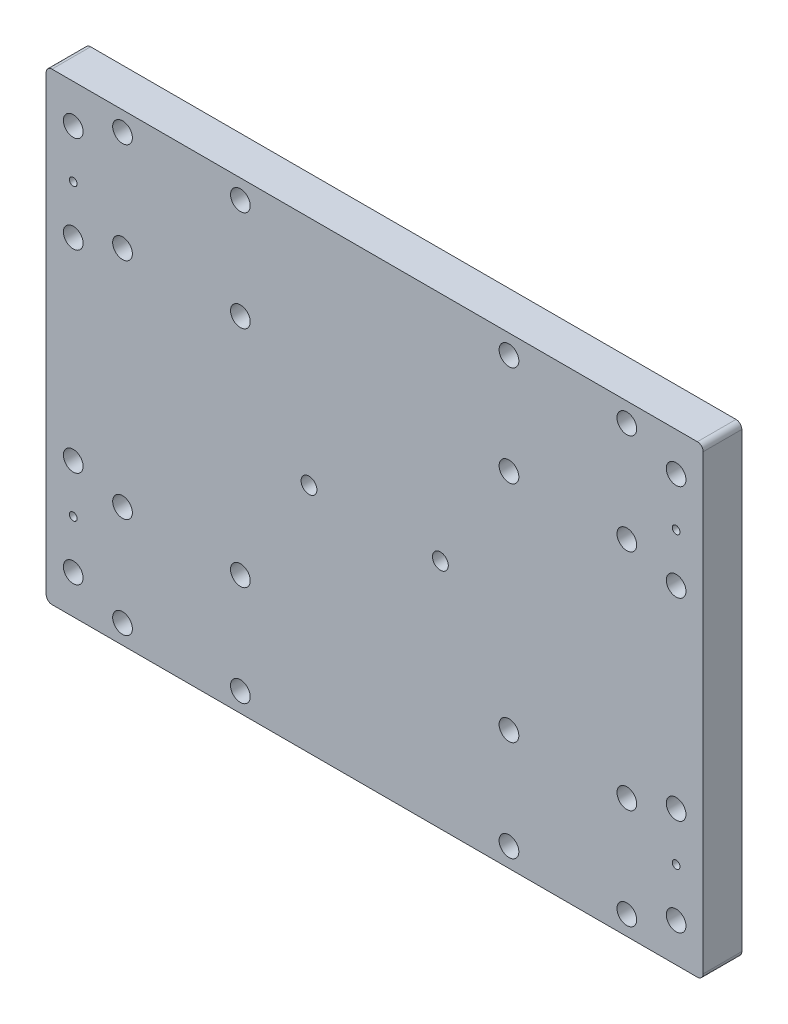
from build123d import *

# Parameters (mm, degrees)
SKETCH1_W           = 170
SKETCH1_H           = 120
BOSS_EXTRUDE1_DEPTH = 5
SKETCH2_R           = 2.55
CUT_EXTRUDE1_DEPTH  = 105.522724802
SKETCH4_R           = 2.05
CUT_EXTRUDE3_DEPTH  = 105.522724802
FILLET1_R           = 1.5
SKETCH6_R           = 2.55
SKETCH6_R_2         = 1
CUT_EXTRUDE5_DEPTH  = 105.522724802


with BuildPart() as part:
    # Sketch1 → Boss-Extrude1 (new, symmetric)
    with BuildSketch(Plane.XY):
        Rectangle(SKETCH1_W, SKETCH1_H)
    extrude(amount=BOSS_EXTRUDE1_DEPTH, both=True)

    # Sketch2 → Cut-Extrude1 (cut, through all)
    with BuildSketch(Plane.XY.offset(5)):
        with Locations((-65.25, 55)):
            Circle(SKETCH2_R)
        with Locations((-34.75, 55)):
            Circle(SKETCH2_R)
        with Locations((-34.75, 29)):
            Circle(SKETCH2_R)
        with Locations((-65.25, 29)):
            Circle(SKETCH2_R)
        with Locations((65.25, 55)):
            Circle(SKETCH2_R)
        with Locations((65.25, 29)):
            Circle(SKETCH2_R)
        with Locations((34.75, 29)):
            Circle(SKETCH2_R)
        with Locations((34.75, 55)):
            Circle(SKETCH2_R)
        with Locations((-65.25, -29)):
            Circle(SKETCH2_R)
        with Locations((-34.75, -29)):
            Circle(SKETCH2_R)
        with Locations((-34.75, -55)):
            Circle(SKETCH2_R)
        with Locations((-65.25, -55)):
            Circle(SKETCH2_R)
        with Locations((34.75, -29)):
            Circle(SKETCH2_R)
        with Locations((65.25, -29)):
            Circle(SKETCH2_R)
        with Locations((65.25, -55)):
            Circle(SKETCH2_R)
        with Locations((34.75, -55)):
            Circle(SKETCH2_R)
    extrude(amount=-CUT_EXTRUDE1_DEPTH, mode=Mode.SUBTRACT)

    # Sketch4 → Cut-Extrude3 (cut, through all)
    with BuildSketch(Plane.XY.offset(5)):
        with Locations((-17, 0)):
            Circle(SKETCH4_R)
        with Locations((17, 0)):
            Circle(SKETCH4_R)
    extrude(amount=-CUT_EXTRUDE3_DEPTH, mode=Mode.SUBTRACT)

    # Fillet1
    fillet1_edges = [part.edges().sort_by_distance(p)[0] for p in [
        (-85, -60, 0),
        (85, -60, 0),
        (85, 60, 0),
        (-85, 60, 0),
    ]]
    fillet(fillet1_edges, radius=FILLET1_R)

    # Sketch6 → Cut-Extrude5 (cut, through all)
    with BuildSketch(Plane.XY.offset(5)):
        with Locations((-78, 50)):
            Circle(SKETCH6_R)
        with Locations((-78, 37.5)):
            Circle(SKETCH6_R_2)
        with Locations((-78, 25)):
            Circle(SKETCH6_R)
        with Locations((-78, -25)):
            Circle(SKETCH6_R)
        with Locations((-78, -37.5)):
            Circle(SKETCH6_R_2)
        with Locations((-78, -50)):
            Circle(SKETCH6_R)
    cut_extrude5 = extrude(amount=-CUT_EXTRUDE5_DEPTH, mode=Mode.SUBTRACT)

    # Mirror1: Cut-Extrude5 across plane
    add(cut_extrude5.mirror(Plane(origin=(0, 0, 0), x_dir=(0, 0, 1), z_dir=(1, 0, 0))), mode=Mode.SUBTRACT)


solid = part.part
